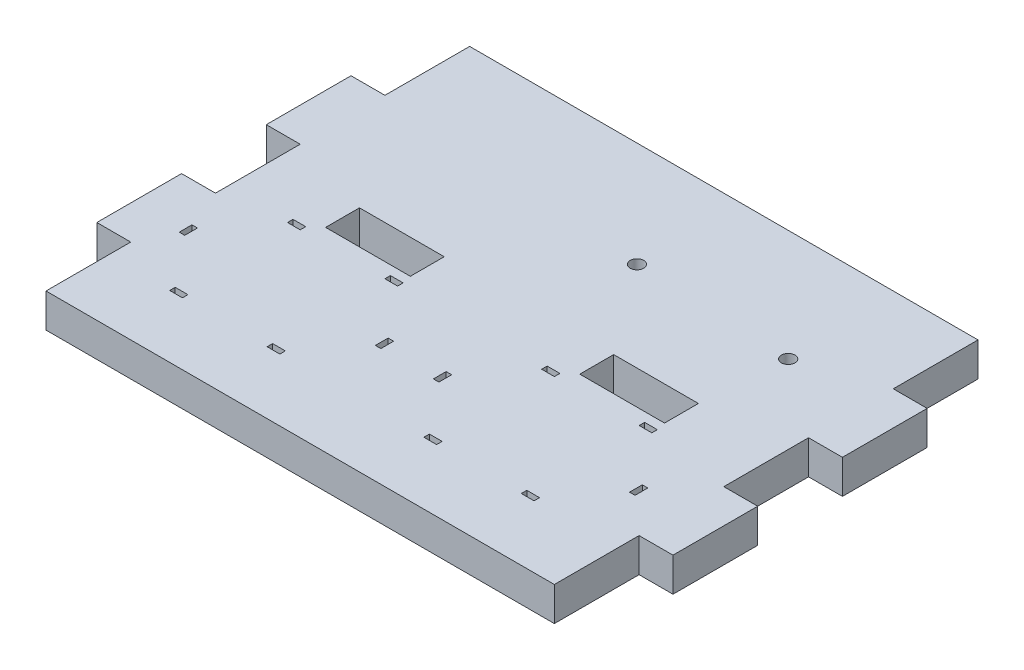
from build123d import *

# Parameters (mm, degrees)
SKETCH1_W           = 120
SKETCH1_H           = 100
SKETCH1_R           = 1.6
SKETCH1_W_2         = 3
SKETCH1_H_2         = 1.3
SKETCH1_W_3         = 1.3
SKETCH1_H_3         = 3
BOSS_EXTRUDE1_DEPTH = 8
CUT_EXTRUDE1_DEPTH  = 4
SKETCH3_W           = 20
SKETCH3_H           = 8
BOSS_EXTRUDE2_DEPTH = 8
CUT_EXTRUDE3_REACH  = 86.782
SKETCH5_W           = 20
SKETCH5_H           = 8


with BuildPart() as part:
    # Sketch1 → Boss-Extrude1 (new body)
    with BuildSketch(Plane(origin=(0, 0, 0), x_dir=(1, 0, 0), z_dir=(0, 1, 0))):
        Rectangle(SKETCH1_W, SKETCH1_H)
        with Locations((41.5, 23.7)):
            Circle(SKETCH1_R, mode=Mode.SUBTRACT)
        with Locations((4.3, 25.2)):
            Circle(SKETCH1_R, mode=Mode.SUBTRACT)
        with Locations((39, -6.85)):
            Rectangle(SKETCH1_W_2, SKETCH1_H_2, mode=Mode.SUBTRACT)
        with Locations((16, -6.85)):
            Rectangle(SKETCH1_W_2, SKETCH1_H_2, mode=Mode.SUBTRACT)
        with Locations((4.35, -20.75)):
            Rectangle(SKETCH1_W_3, SKETCH1_H_3, mode=Mode.SUBTRACT)
        with Locations((50.65, -20.75)):
            Rectangle(SKETCH1_W_3, SKETCH1_H_3, mode=Mode.SUBTRACT)
        with Locations((39, -34.65)):
            Rectangle(SKETCH1_W_2, SKETCH1_H_2, mode=Mode.SUBTRACT)
        with Locations((16, -34.65)):
            Rectangle(SKETCH1_W_2, SKETCH1_H_2, mode=Mode.SUBTRACT)
        with Locations((-21, -34.65)):
            Rectangle(SKETCH1_W_2, SKETCH1_H_2, mode=Mode.SUBTRACT)
        with Locations((-44, -34.65)):
            Rectangle(SKETCH1_W_2, SKETCH1_H_2, mode=Mode.SUBTRACT)
        with Locations((-55.65, -20.75)):
            Rectangle(SKETCH1_W_3, SKETCH1_H_3, mode=Mode.SUBTRACT)
        with Locations((-44, -6.85)):
            Rectangle(SKETCH1_W_2, SKETCH1_H_2, mode=Mode.SUBTRACT)
        with Locations((-9.35, -20.75)):
            Rectangle(SKETCH1_W_3, SKETCH1_H_3, mode=Mode.SUBTRACT)
        with Locations((-21, -6.85)):
            Rectangle(SKETCH1_W_2, SKETCH1_H_2, mode=Mode.SUBTRACT)
    extrude(amount=BOSS_EXTRUDE1_DEPTH)

    # Sketch2 → Cut-Extrude1 (cut)
    with BuildSketch(Plane(origin=(0, 0, 0), x_dir=(-1, 0, 0), z_dir=(0, -1, 0))):
        Polygon((-7.475426481, 25.2), (-5.88771324, 22.45), (-2.71228676, 22.45), (-1.124573519, 25.2), (-2.71228676, 27.95), (-5.88771324, 27.95), align=None)
        Polygon((-44.675426481, 23.7), (-43.08771324, 20.95), (-39.91228676, 20.95), (-38.324573519, 23.7), (-39.91228676, 26.45), (-43.08771324, 26.45), align=None)
    extrude(amount=-CUT_EXTRUDE1_DEPTH, mode=Mode.SUBTRACT)

    # Sketch3 → Boss-Extrude2 (add)
    with BuildSketch(Plane.ZY.offset(60)):
        with Locations((-20, 4)):
            Rectangle(SKETCH3_W, SKETCH3_H)
        with Locations((20, 4)):
            Rectangle(SKETCH3_W, SKETCH3_H)
    boss_extrude2 = extrude(amount=BOSS_EXTRUDE2_DEPTH)

    # Mirror1: Boss-Extrude2 across plane
    add(boss_extrude2.mirror(Plane.ZY))

    # Sketch5 → Cut-Extrude3 (cut, up to next)
    with BuildSketch(Plane(origin=(0, 0, 0), x_dir=(-1, 0, 0), z_dir=(0, -1, 0)), mode=Mode.PRIVATE) as cut_extrude3_sk1:
        with Locations((30, 0)):
            Rectangle(SKETCH5_W, SKETCH5_H)
    cut_extrude3_tool1 = extrude(cut_extrude3_sk1.sketch, amount=-CUT_EXTRUDE3_REACH, mode=Mode.PRIVATE) & part.part
    cut_extrude3 = cut_extrude3_tool1.solids().sort_by_distance((-30, 0, 0))[0]
    add(cut_extrude3, mode=Mode.SUBTRACT)

    # Mirror2: Cut-Extrude3 across plane
    add(cut_extrude3.mirror(Plane.ZY), mode=Mode.SUBTRACT)


solid = part.part
